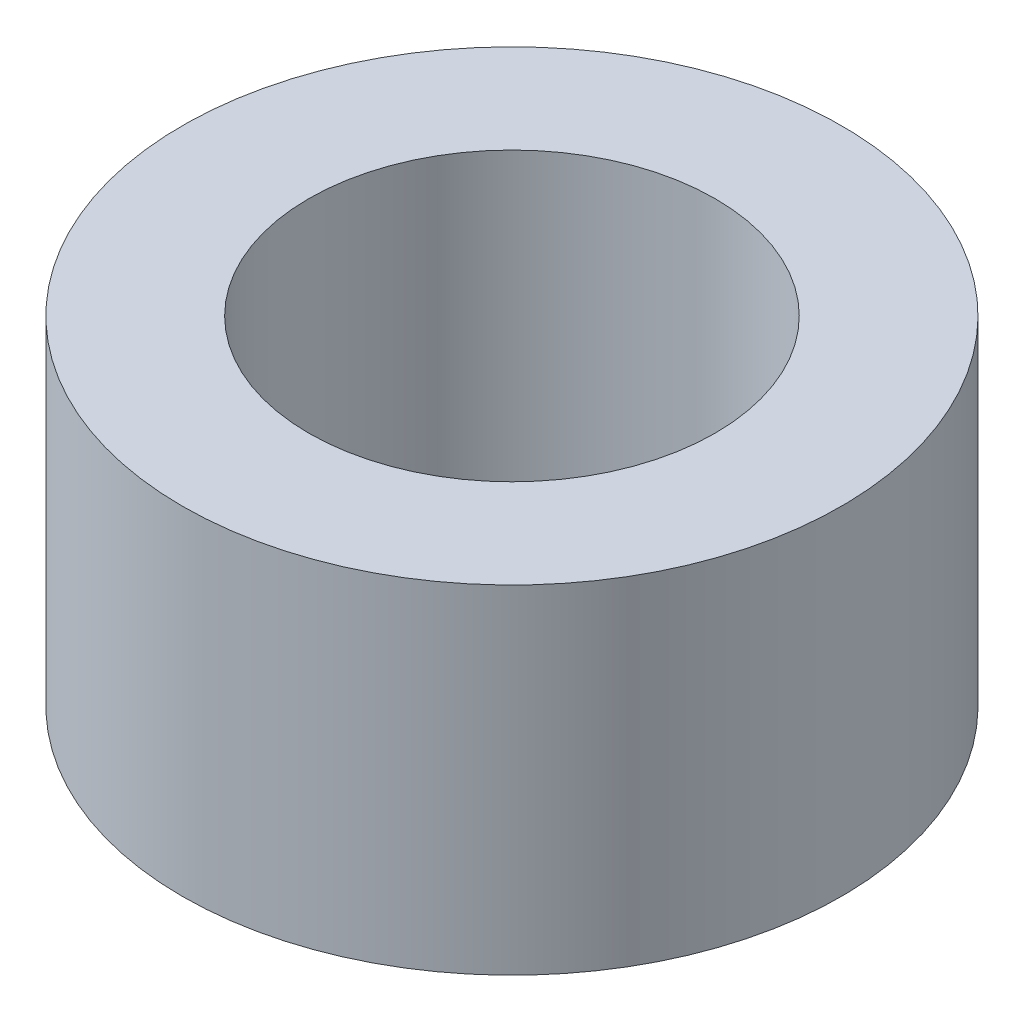
from build123d import *

# Parameters (mm, degrees)
SKETCH1_R           = 7.5
BOSS_EXTRUDE1_DEPTH = 7.690862002
SKETCH2_R           = 4.623618262
CUT_EXTRUDE1_DEPTH  = 14.10150214


with BuildPart() as part:
    # Sketch1 → Boss-Extrude1 (new body)
    with BuildSketch(Plane(origin=(0, 0, 0), x_dir=(1, 0, 0), z_dir=(0, 1, 0))):
        Circle(SKETCH1_R)
    extrude(amount=BOSS_EXTRUDE1_DEPTH)

    # Sketch2 → Cut-Extrude1 (cut, through all)
    with BuildSketch(Plane(origin=(0, 0, 0), x_dir=(1, 0, 0), z_dir=(0, 1, 0))):
        Circle(SKETCH2_R)
    extrude(amount=CUT_EXTRUDE1_DEPTH, mode=Mode.SUBTRACT)


solid = part.part
